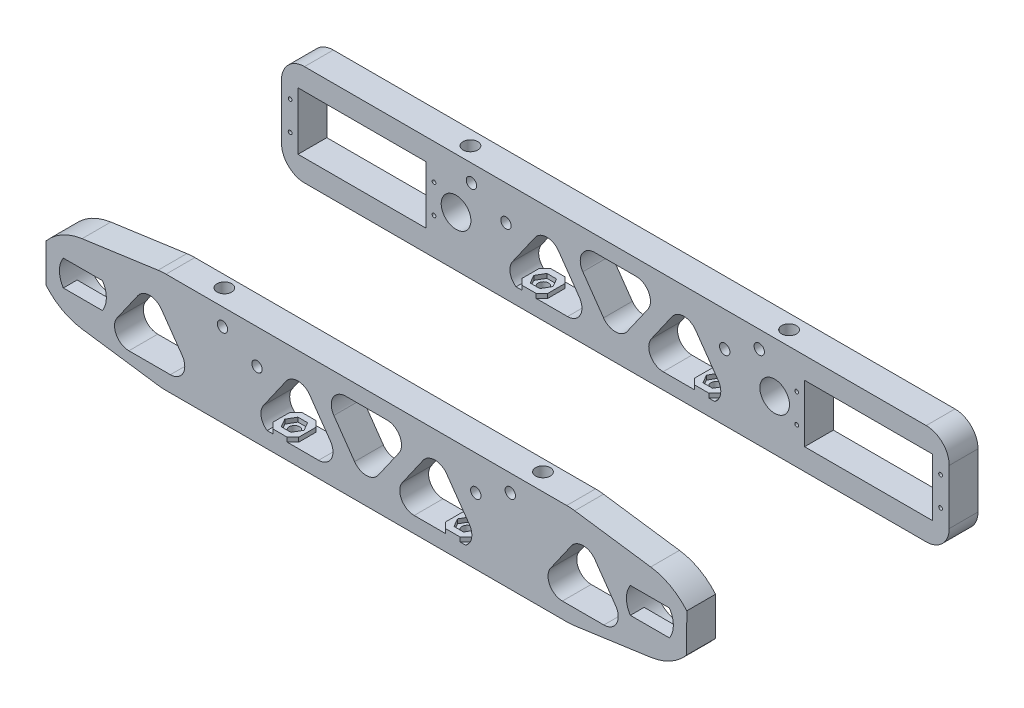
from build123d import *
from OCP.BRepFilletAPI import BRepFilletAPI_MakeChamfer

# Parameters (mm, degrees)
SKETCH1_W           = 232
SKETCH1_H           = 35
SKETCH1_R           = 5.15
BOSS_EXTRUDE1_DEPTH = 10
BOSS_EXTRUDE2_START = -2
SKETCH2_R           = 5.15
BOSS_EXTRUDE2_DEPTH = 2
SKETCH3_W           = 232
SKETCH3_H           = 35
SKETCH3_R           = 0.65
SKETCH3_R_2         = 5.15
SKETCH3_W_2         = 44.5
SKETCH3_H_2         = 20
BOSS_EXTRUDE3_DEPTH = 10
SKETCH4_R           = 2.55
CUT_EXTRUDE1_DEPTH  = 10
CHAMFER1_SIZE       = 45
CHAMFER1_SIZE2      = 6.324337562
FILLET1_R           = 8
CUT_EXTRUDE3_DEPTH  = 10
SKETCH7_R           = 1.8
CUT_EXTRUDE4_DEPTH  = 10
SKETCH7_3_W         = 9
SKETCH7_3_H         = 10
BOSS_EXTRUDE4_DEPTH = 1.5
CHAMFER2_SIZE       = 2
CHAMFER3_SIZE       = 2
FILLET2_R           = 20
SKETCH1_3_R         = 8.15
CUT_EXTRUDE5_DEPTH  = 5.2
CUT_EXTRUDE6_DEPTH  = 251.062492189
SKETCH9_R           = 0.65
CUT_EXTRUDE7_DEPTH  = 5.2
FILLET3_R           = 5
FILLET4_R           = 5
SKETCH14_R          = 1.8
CUT_EXTRUDE10_DEPTH = 254.695191125


with BuildPart() as part:
    # Sketch1 → Boss-Extrude1 (new body)
    with BuildSketch(Plane.XY):
        with Locations((-116, 17.5)):
            Rectangle(SKETCH1_W, SKETCH1_H)
        with Locations((-171.35, 17.5)):
            Circle(SKETCH1_R, mode=Mode.SUBTRACT)
        with Locations((-60.65, 17.5)):
            Circle(SKETCH1_R, mode=Mode.SUBTRACT)
        Polygon((-156.609961834, 5.5), (-139.804980917, 29.5), (-123, 5.5), align=None, mode=Mode.SUBTRACT)
        Polygon((-132.804980917, 29.5), (-116, 5.5), (-99.195019083, 29.5), align=None, mode=Mode.SUBTRACT)
        Polygon((-92.195019083, 29.5), (-109, 5.5), (-75.390038166, 5.5), align=None, mode=Mode.SUBTRACT)
    extrude(amount=BOSS_EXTRUDE1_DEPTH)

    # Sketch2 → Boss-Extrude2 (add)
    with BuildSketch(Plane.XY.offset(10).offset(BOSS_EXTRUDE2_START)):
        with Locations((-60.65, 17.5)):
            Circle(SKETCH2_R)
        with Locations((-171.35, 17.5)):
            Circle(SKETCH2_R)
    extrude(amount=BOSS_EXTRUDE2_DEPTH)


with BuildPart() as body_2:
    # Sketch3 → Boss-Extrude3 (new body)
    with BuildSketch(Plane.XY.offset(-76.5)):
        with Locations((-116, 17.5)):
            Rectangle(SKETCH3_W, SKETCH3_H)
        with Locations((-179, 12.728163815)):
            Circle(SKETCH3_R, mode=Mode.SUBTRACT)
        with Locations((-179, 22.728163815)):
            Circle(SKETCH3_R, mode=Mode.SUBTRACT)
        with Locations((-229, 12.728163815)):
            Circle(SKETCH3_R, mode=Mode.SUBTRACT)
        with Locations((-229, 22.728163815)):
            Circle(SKETCH3_R, mode=Mode.SUBTRACT)
        with Locations((-171.35, 17.5)):
            Circle(SKETCH3_R_2, mode=Mode.SUBTRACT)
        with Locations(Location((-3, 22.728163815, 0), (0, 0, 180))):
            Circle(SKETCH3_R, mode=Mode.SUBTRACT)
        with Locations(Location((-3, 12.728163815, 0), (0, 0, 180))):
            Circle(SKETCH3_R, mode=Mode.SUBTRACT)
        with Locations(Location((-53, 12.728163815, 0), (0, 0, 180))):
            Circle(SKETCH3_R, mode=Mode.SUBTRACT)
        with Locations(Location((-53, 22.728163815, 0), (0, 0, 180))):
            Circle(SKETCH3_R, mode=Mode.SUBTRACT)
        with Locations(Location((-60.65, 17.5, 0), (0, 0, 180))):
            Circle(SKETCH3_R_2, mode=Mode.SUBTRACT)
        with Locations((-204, 17.5)):
            Rectangle(SKETCH3_W_2, SKETCH3_H_2, mode=Mode.SUBTRACT)
        with Locations((-28, 17.5)):
            Rectangle(SKETCH3_W_2, SKETCH3_H_2, mode=Mode.SUBTRACT)
        Polygon((-92.195019083, 29.5), (-109, 5.5), (-75.390038166, 5.5), align=None, mode=Mode.SUBTRACT)
        Polygon((-116, 5.5), (-99.195019083, 29.5), (-132.804980917, 29.5), align=None, mode=Mode.SUBTRACT)
        Polygon((-123, 5.5), (-156.609961834, 5.5), (-139.804980917, 29.5), align=None, mode=Mode.SUBTRACT)
    extrude(amount=-BOSS_EXTRUDE3_DEPTH)


with BuildPart() as cut_extrude1_tool:
    # Sketch4 → Cut-Extrude1 (new body)
    with BuildSketch(Plane(origin=(0, 35, 0), x_dir=(1, 0, 0), z_dir=(0, 1, 0))):
        with Locations(Location((-171.35, -4, 0), (0, 0, 270))):
            Circle(SKETCH4_R)
        with Locations(Location((-60.65, -4, 0), (0, 0, 90))):
            Circle(SKETCH4_R)
        with Locations(Location((-171.35, 81.5, 0), (0, 0, 270))):
            Circle(SKETCH4_R)
        with Locations(Location((-60.65, 81.5, 0), (0, 0, 90))):
            Circle(SKETCH4_R)
    extrude(amount=-CUT_EXTRUDE1_DEPTH)


with BuildPart() as part_1:
    add(part.part)

    # Cut-Extrude1: cut by cut_extrude1_tool
    add(cut_extrude1_tool.part, mode=Mode.SUBTRACT)

    # Chamfer1: one chamfer whose edges measure the first distance from different faces: ONE call of the kernel's chamfer builder (chamfer() names one face for all edges)
    chamfer1_edges_1 = [part_1.edges().sort_by_distance(p)[0] for p in [
        (0, 0, 5),
        (-232, 0, 5),
    ]]
    chamfer1_side_1 = [part_1.faces().sort_by_distance(p)[0] for p in [
        (-116, 0, 5),
    ]]
    chamfer1_edges_2 = [part_1.edges().sort_by_distance(p)[0] for p in [
        (-232, 35, 5),
        (0, 35, 5),
    ]]
    chamfer1_side_2 = [part_1.faces().sort_by_distance(p)[0] for p in [
        (-116, 35, 5.017926213),
    ]]
    chamfer1 = BRepFilletAPI_MakeChamfer(part_1.part.solid().wrapped)
    for e in chamfer1_edges_1:
        chamfer1.Add(CHAMFER1_SIZE, CHAMFER1_SIZE2, e.wrapped, chamfer1_side_1[0].wrapped)  # the first distance lies on this face
    for e in chamfer1_edges_2:
        chamfer1.Add(CHAMFER1_SIZE, CHAMFER1_SIZE2, e.wrapped, chamfer1_side_2[0].wrapped)  # the first distance lies on this face
    add(Compound.cast(chamfer1.Shape()), mode=Mode.REPLACE)

    # Sketch6 → Cut-Extrude3 (cut)
    with BuildSketch(Plane.XY.offset(10)):
        Polygon((-174.5, 5.5), (-208.109961834, 5.5), (-191.304980917, 29.5), align=None)
        Polygon((-57.5, 5.5), (-23.890038166, 5.5), (-40.695019083, 29.5), align=None)
    extrude(amount=-CUT_EXTRUDE3_DEPTH, mode=Mode.SUBTRACT)


with BuildPart() as body_2_1:
    add(body_2.part)

    # Cut-Extrude1: cut by cut_extrude1_tool
    add(cut_extrude1_tool.part, mode=Mode.SUBTRACT)

    # Fillet1
    fillet1_edges = [body_2_1.edges().sort_by_distance(p)[0] for p in [
        (0, 0, -81.5),
        (-232, 0, -81.5),
        (-232, 35, -81.5),
        (0, 35, -81.5),
    ]]
    fillet(fillet1_edges, radius=FILLET1_R)


with BuildPart() as cut_extrude4_tool:
    # Sketch7 → Cut-Extrude4 (new body)
    with BuildSketch(Plane(origin=(0, 5.5, 0), x_dir=(1, 0, 0), z_dir=(0, 1, 0))):
        with Locations(Location((-146, -5, 0), (0, 0, 180))):
            Circle(SKETCH7_R)
        with Locations(Location((-86, -5, 0), (0, 0, 180))):
            Circle(SKETCH7_R)
        with Locations(Location((-146, 81.5, 0), (0, 0, 180))):
            Circle(SKETCH7_R)
        with Locations(Location((-86, 81.5, 0), (0, 0, 180))):
            Circle(SKETCH7_R)
    extrude(amount=-CUT_EXTRUDE4_DEPTH)


with BuildPart() as part_2:
    add(part_1.part)

    # Cut-Extrude4: cut by cut_extrude4_tool
    add(cut_extrude4_tool.part, mode=Mode.SUBTRACT)



with BuildPart() as body_2_2:
    add(body_2_1.part)

    # Cut-Extrude4: cut by cut_extrude4_tool
    add(cut_extrude4_tool.part, mode=Mode.SUBTRACT)


with BuildPart() as part_3:
    add(part_2.part)

    add(body_2_2.part)  # Boss-Extrude4 merges body 2
    # Sketch7<3> → Boss-Extrude4 (add)
    # profile 1 of 4: a face of its own
    with BuildSketch(Plane(origin=(0, 5.5, 0), x_dir=(1, 0, 0), z_dir=(0, 1, 0))):
        with Locations((-146, -5)):
            Rectangle(SKETCH7_3_W, SKETCH7_3_H)
        Polygon((-147.674315781, -2.1), (-149.348631561, -5), (-147.674315781, -7.9), (-144.325684219, -7.9), (-142.651368439, -5), (-144.325684219, -2.1), align=None, mode=Mode.SUBTRACT)
    # profile 2 of 4: a face of its own
    with BuildSketch(Plane(origin=(0, 5.5, 0), x_dir=(1, 0, 0), z_dir=(0, 1, 0))):
        with Locations((-86, -5)):
            Rectangle(SKETCH7_3_W, SKETCH7_3_H)
        Polygon((-89.348631561, -5), (-87.674315781, -2.1), (-84.325684219, -2.1), (-82.651368439, -5), (-84.325684219, -7.9), (-87.674315781, -7.9), align=None, mode=Mode.SUBTRACT)
    # profile 3 of 4: a face of its own
    with BuildSketch(Plane(origin=(0, 5.5, 0), x_dir=(1, 0, 0), z_dir=(0, 1, 0))):
        with Locations((-86, 81.5)):
            Rectangle(SKETCH7_3_W, SKETCH7_3_H)
        Polygon((-82.651368439, 81.5), (-84.325684219, 84.4), (-87.674315781, 84.4), (-89.348631561, 81.5), (-87.674315781, 78.6), (-84.325684219, 78.6), align=None, mode=Mode.SUBTRACT)
    # profile 4 of 4: a face of its own
    with BuildSketch(Plane(origin=(0, 5.5, 0), x_dir=(1, 0, 0), z_dir=(0, 1, 0))):
        with Locations((-146, 81.5)):
            Rectangle(SKETCH7_3_W, SKETCH7_3_H)
        Polygon((-144.325684219, 78.6), (-147.674315781, 78.6), (-149.348631561, 81.5), (-147.674315781, 84.4), (-144.325684219, 84.4), (-142.651368439, 81.5), align=None, mode=Mode.SUBTRACT)
    extrude(amount=BOSS_EXTRUDE4_DEPTH)

    # Chamfer2
    chamfer2_edges = [part_3.edges().sort_by_distance(p)[0] for p in [
        (-81.5, 6.25, -76.5),
        (-81.5, 6.25, -86.5),
        (-90.5, 6.25, -86.5),
        (-90.5, 6.25, -76.5),
        (-141.5, 6.25, -76.5),
        (-141.5, 6.25, -86.5),
        (-150.5, 6.25, -86.5),
        (-150.5, 6.25, -76.5),
    ]]
    chamfer(chamfer2_edges, length=CHAMFER2_SIZE)

    # Chamfer3
    chamfer3_edges = [part_3.edges().sort_by_distance(p)[0] for p in [
        (-150.5, 6.25, 0),
        (-150.5, 6.25, 10),
        (-141.5, 6.25, 10),
        (-141.5, 6.25, 0),
        (-90.5, 6.25, 0),
        (-90.5, 6.25, 10),
        (-81.5, 6.25, 10),
        (-81.5, 6.25, 0),
    ]]
    chamfer(chamfer3_edges, length=CHAMFER3_SIZE)

    # Fillet2
    # the kernel refuses this fillet: 20 mm, written as the material it takes off along each edge
    with BuildSketch(Plane(origin=(-45, 35, -3.496340597), x_dir=(0.9902680687415703, -0.13917310096006527, 0), z_dir=(0, 0, 1)), Plane(origin=(-45, 0, -3.496340597), x_dir=(-1, 0, 0), z_dir=(0, 0, 1)), Plane(origin=(-187, 0, -3.496340597), x_dir=(-0.9902680687415703, 0.13917310096006638, 0), z_dir=(0, 0, 1))) as fillet2_piece_1:
        with BuildLine():
            CenterArc((FILLET2_R * 0.0699268119435, -FILLET2_R), FILLET2_R, 90, 8)
            Line((-FILLET2_R * 0.0692462890166, -FILLET2_R * 0.00973193125843), (0, 0))
            Line((0, 0), (FILLET2_R * 0.0699268119435, 0))
        make_face()
    extrude(amount=16.992681194, mode=Mode.SUBTRACT)
    with BuildSketch(Plane(origin=(0, 6.324337562, -43.464336891), x_dir=(-0.9902680687415703, -0.13917310096006572, 0), z_dir=(0, 0, 1)), Plane(origin=(0, 28.675662438, -43.464336891), x_dir=(0, -1, 0), z_dir=(0, 0, 1)), Plane(origin=(-232, 6.324337562, -43.464336891), x_dir=(0, 1, 0), z_dir=(0, 0, 1)), Plane(origin=(-232, 28.675662438, -43.464336891), x_dir=(0.9902680687415703, 0.13917310096006563, 0), z_dir=(0, 0, 1))) as fillet2_piece_2:
        with BuildLine():
            CenterArc((FILLET2_R * 0.869286737816, -FILLET2_R), FILLET2_R, 90, 82)
            Line((-FILLET2_R * 0.120981330925, -FILLET2_R * 0.86082689904), (0, 0))
            Line((0, 0), (FILLET2_R * 0.869286737816, 0))
        make_face()
    extrude(amount=96.928673782, mode=Mode.SUBTRACT)
    with BuildSketch(Plane(origin=(-187, 35, -3.496340597), x_dir=(-0.9902680687415706, -0.13917310096006388, 0), z_dir=(0, 0, 1))) as fillet2_piece_3:
        with BuildLine():
            CenterArc((FILLET2_R * 0.0699268119435, FILLET2_R), FILLET2_R, 262, 8)
            Line((-FILLET2_R * 0.0692462890166, FILLET2_R * 0.00973193125843), (0, 0))
            Line((0, 0), (FILLET2_R * 0.0699268119435, 0))
        make_face()
    extrude(amount=16.992681194, mode=Mode.SUBTRACT)

    # Sketch1<3> → Cut-Extrude5 (cut)
    with BuildSketch(Plane.XY):
        with Locations((-214.5, 17.5)):
            Circle(SKETCH1_3_R)
        with Locations((-17.5, 17.5)):
            Circle(SKETCH1_3_R)
    extrude(amount=CUT_EXTRUDE5_DEPTH, mode=Mode.SUBTRACT)

    # Sketch8 → Cut-Extrude6 (cut, through all)
    with BuildSketch(Plane(origin=(0, 0, 0), x_dir=(-1, 0, 0), z_dir=(0, 0, -1))):
        with BuildLine():
            Line((10.704965048, 22), (24.295034952, 22))
            ThreePointArc((24.295034952, 22), (25.65, 17.5), (24.295034952, 13))
            Line((24.295034952, 13), (10.704965048, 13))
            ThreePointArc((10.704965048, 13), (9.35, 17.5), (10.704965048, 22))
        make_face()
        with BuildLine():
            Line((207.704965048, 22), (221.295034952, 22))
            ThreePointArc((221.295034952, 22), (222.65, 17.5), (221.295034952, 13))
            Line((221.295034952, 13), (207.704965048, 13))
            ThreePointArc((207.704965048, 13), (206.35, 17.5), (207.704965048, 22))
        make_face()
    extrude(amount=-CUT_EXTRUDE6_DEPTH, mode=Mode.SUBTRACT)

    # Sketch9 → Cut-Extrude7 (cut)
    with BuildSketch(Plane(origin=(0, 25, 0), x_dir=(1, 0, 0), z_dir=(0, 1, 0))):
        with Locations(Location((-171.35, -4, 0), (0, 0, 270))):
            Circle(SKETCH9_R)
        with Locations(Location((-60.65, -4, 0), (0, 0, 270))):
            Circle(SKETCH9_R)
        with Locations(Location((-60.65, 81.5, 0), (0, 0, 270))):
            Circle(SKETCH9_R)
        with Locations(Location((-171.35, 81.5, 0), (0, 0, 270))):
            Circle(SKETCH9_R)
    extrude(amount=-CUT_EXTRUDE7_DEPTH, mode=Mode.SUBTRACT)

    # Fillet3
    # the kernel refuses this fillet: 5 mm, written as the material it adds along each edge
    with BuildSketch(Plane(origin=(-156.609961834, 5.5, -76.5), x_dir=(1, 0, 0), z_dir=(0, 0, -1))) as fillet3_piece_1:
        with BuildLine():
            CenterArc((8.973756882, -4.098619026), FILLET3_R, 124.94284485, 90.05715515)
            Line((4.877996661, -6.966501208), (4.796081456, -7.023858852))
            Line((4.796081456, -7.023858852), (-0.081915204, -0.057357644))
            Line((-0.081915204, -0.057357644), (0, 0.1))
            ThreePointArc((0, 0.1), (3.054980917, 0.1), (6.052685933, 0.081972381))
            Line((6.052685933, 0.081972381), (6.109961834, 0))
        make_face()
    extrude(amount=10)
    with BuildSketch(Plane(origin=(-92.195019083, 29.5, -76.5), x_dir=(-0.573576436351047, -0.8191520442889911, 0), z_dir=(0, 0, -1)), Plane(origin=(-139.804980917, 29.5, -76.5), x_dir=(-0.5735764363510435, -0.8191520442889936, 0), z_dir=(0, 0, -1))) as fillet3_piece_2:
        with BuildLine():
            CenterArc((FILLET3_R * 1.42814800674, -FILLET3_R), FILLET3_R, 90, 110)
            Line((FILLET3_R * 0.488455385956, -FILLET3_R * 1.34202014333), (FILLET3_R * 0.46966153354, -FILLET3_R * 1.34886054619))
            Line((FILLET3_R * 0.46966153354, -FILLET3_R * 1.34886054619), (-FILLET3_R * 0.0285629601348, FILLET3_R * 0.02))
            Line((-FILLET3_R * 0.0285629601348, FILLET3_R * 0.02), (FILLET3_R * 1.42814800674, FILLET3_R * 0.02))
            Line((FILLET3_R * 1.42814800674, FILLET3_R * 0.02), (FILLET3_R * 1.42814800674, 0))
        make_face()
    extrude(amount=10)
    with BuildSketch(Plane(origin=(-75.390038166, 5.5, -76.5), x_dir=(-0.5735764363510428, 0.8191520442889941, 0), z_dir=(0, 0, -1))) as fillet3_piece_3:
        with BuildLine():
            CenterArc((8.504527647, -5), FILLET3_R, 90, 90.05715515)
            Line((3.504530135, -5.004987727), (3.404530185, -5.005087481))
            ThreePointArc((3.404530185, -5.005087481), (1.670349863, -2.559851507), (-0.081915204, -0.057357644))
            Line((-0.081915204, -0.057357644), (0, 0.1))
            Line((0, 0.1), (8.504527647, 0.1))
            Line((8.504527647, 0.1), (8.504527647, 0))
        make_face()
    extrude(amount=10)
    with BuildSketch(Plane(origin=(-109, 5.5, -76.5), x_dir=(1, 0, 0), z_dir=(0, 0, -1)), Plane(origin=(-132.804980917, 29.5, -76.5), x_dir=(0.5735764363510458, -0.819152044288992, 0), z_dir=(0, 0, -1)), Plane(origin=(-99.195019083, 29.5, -76.5), x_dir=(-1, 0, 0), z_dir=(0, 0, -1)), Plane(origin=(-123, 5.5, -76.5), x_dir=(-0.5735764363510468, 0.8191520442889912, 0), z_dir=(0, 0, -1))) as fillet3_piece_4:
        with BuildLine():
            CenterArc((FILLET3_R * 1.92098212697, -FILLET3_R), FILLET3_R, 90, 125)
            Line((FILLET3_R * 1.10183008268, -FILLET3_R * 1.57357643635), (FILLET3_R * 1.0854470418, -FILLET3_R * 1.58504796508))
            Line((FILLET3_R * 1.0854470418, -FILLET3_R * 1.58504796508), (-FILLET3_R * 0.0163830408858, -FILLET3_R * 0.011471528727))
            Line((-FILLET3_R * 0.0163830408858, -FILLET3_R * 0.011471528727), (0, FILLET3_R * 0.02))
            Line((0, FILLET3_R * 0.02), (FILLET3_R * 1.92098212697, FILLET3_R * 0.02))
            Line((FILLET3_R * 1.92098212697, FILLET3_R * 0.02), (FILLET3_R * 1.92098212697, 0))
        make_face()
    extrude(amount=10)
    with BuildSketch(Plane(origin=(-116, 5.5, -76.5), x_dir=(-0.5735764363510453, 0.8191520442889924, 0), z_dir=(0, 0, -1))) as fillet3_piece_5:
        with BuildLine():
            CenterArc((FILLET3_R * 1.42814800674, FILLET3_R), FILLET3_R, 160, 110)
            Line((FILLET3_R * 0.488455385956, FILLET3_R * 1.34202014333), (FILLET3_R * 0.46966153354, FILLET3_R * 1.34886054619))
            Line((FILLET3_R * 0.46966153354, FILLET3_R * 1.34886054619), (-FILLET3_R * 0.0285629601348, -FILLET3_R * 0.02))
            Line((-FILLET3_R * 0.0285629601348, -FILLET3_R * 0.02), (FILLET3_R * 1.42814800674, -FILLET3_R * 0.02))
            Line((FILLET3_R * 1.42814800674, -FILLET3_R * 0.02), (FILLET3_R * 1.42814800674, 0))
        make_face()
    extrude(amount=10)

    # Fillet4
    # the kernel refuses this fillet: 5 mm, written as the material it adds along each edge
    with BuildSketch(Plane(origin=(-40.695019083, 29.5, 10), x_dir=(-0.5735764363510464, -0.8191520442889916, 0), z_dir=(0, 0, -1)), Plane(origin=(-139.804980917, 29.5, 0), x_dir=(0.5735764363510456, -0.819152044288992, 0), z_dir=(0, 0, 1)), Plane(origin=(-116, 5.5, 0), x_dir=(-0.5735764363510455, 0.8191520442889922, 0), z_dir=(0, 0, 1))) as fillet4_piece_1:
        with BuildLine():
            CenterArc((FILLET4_R * 1.42814800674, -FILLET4_R), FILLET4_R, 90, 110)
            Line((FILLET4_R * 0.488455385956, -FILLET4_R * 1.34202014333), (FILLET4_R * 0.46966153354, -FILLET4_R * 1.34886054619))
            Line((FILLET4_R * 0.46966153354, -FILLET4_R * 1.34886054619), (-FILLET4_R * 0.0285629601348, FILLET4_R * 0.02))
            Line((-FILLET4_R * 0.0285629601348, FILLET4_R * 0.02), (FILLET4_R * 1.42814800674, FILLET4_R * 0.02))
            Line((FILLET4_R * 1.42814800674, FILLET4_R * 0.02), (FILLET4_R * 1.42814800674, 0))
        make_face()
    extrude(amount=10)
    with BuildSketch(Plane(origin=(-23.890038166, 5.5, 10), x_dir=(-0.5735764363510432, 0.8191520442889938, 0), z_dir=(0, 0, -1)), Plane(origin=(-208.109961834, 5.5, 10), x_dir=(1, 0, 0), z_dir=(0, 0, -1)), Plane(origin=(-123, 5.5, 0), x_dir=(-1, 0, 0), z_dir=(0, 0, 1))) as fillet4_piece_2:
        with BuildLine():
            CenterArc((FILLET4_R * 1.92098212697, -FILLET4_R), FILLET4_R, 90, 125)
            Line((FILLET4_R * 1.10183008268, -FILLET4_R * 1.57357643635), (FILLET4_R * 1.0854470418, -FILLET4_R * 1.58504796508))
            Line((FILLET4_R * 1.0854470418, -FILLET4_R * 1.58504796508), (-FILLET4_R * 0.0163830408858, -FILLET4_R * 0.011471528727))
            Line((-FILLET4_R * 0.0163830408858, -FILLET4_R * 0.011471528727), (0, FILLET4_R * 0.02))
            Line((0, FILLET4_R * 0.02), (FILLET4_R * 1.92098212697, FILLET4_R * 0.02))
            Line((FILLET4_R * 1.92098212697, FILLET4_R * 0.02), (FILLET4_R * 1.92098212697, 0))
        make_face()
    extrude(amount=10)
    with BuildSketch(Plane(origin=(-57.5, 5.5, 10), x_dir=(0.5735764363510462, 0.8191520442889918, 0), z_dir=(0, 0, -1)), Plane(origin=(-174.5, 5.5, 10), x_dir=(-1, 0, 0), z_dir=(0, 0, -1)), Plane(origin=(-132.804980917, 29.5, 0), x_dir=(0.5735764363510468, -0.8191520442889912, 0), z_dir=(0, 0, 1)), Plane(origin=(-99.195019083, 29.5, 0), x_dir=(-1, 0, 0), z_dir=(0, 0, 1)), Plane(origin=(-109, 5.5, 0), x_dir=(1, 0, 0), z_dir=(0, 0, 1))) as fillet4_piece_3:
        with BuildLine():
            CenterArc((FILLET4_R * 1.92098212697, FILLET4_R), FILLET4_R, 145, 125)
            Line((FILLET4_R * 1.10183008268, FILLET4_R * 1.57357643635), (FILLET4_R * 1.0854470418, FILLET4_R * 1.58504796508))
            Line((FILLET4_R * 1.0854470418, FILLET4_R * 1.58504796508), (-FILLET4_R * 0.0163830408858, FILLET4_R * 0.011471528727))
            Line((-FILLET4_R * 0.0163830408858, FILLET4_R * 0.011471528727), (0, -FILLET4_R * 0.02))
            Line((0, -FILLET4_R * 0.02), (FILLET4_R * 1.92098212697, -FILLET4_R * 0.02))
            Line((FILLET4_R * 1.92098212697, -FILLET4_R * 0.02), (FILLET4_R * 1.92098212697, 0))
        make_face()
    extrude(amount=10)
    with BuildSketch(Plane(origin=(-191.304980917, 29.5, 10), x_dir=(0.5735764363510456, -0.819152044288992, 0), z_dir=(0, 0, -1)), Plane(origin=(-92.195019083, 29.5, 0), x_dir=(-0.5735764363510464, -0.8191520442889916, 0), z_dir=(0, 0, 1))) as fillet4_piece_4:
        with BuildLine():
            CenterArc((FILLET4_R * 1.42814800674, FILLET4_R), FILLET4_R, 160, 110)
            Line((FILLET4_R * 0.488455385956, FILLET4_R * 1.34202014333), (FILLET4_R * 0.46966153354, FILLET4_R * 1.34886054619))
            Line((FILLET4_R * 0.46966153354, FILLET4_R * 1.34886054619), (-FILLET4_R * 0.0285629601348, -FILLET4_R * 0.02))
            Line((-FILLET4_R * 0.0285629601348, -FILLET4_R * 0.02), (FILLET4_R * 1.42814800674, -FILLET4_R * 0.02))
            Line((FILLET4_R * 1.42814800674, -FILLET4_R * 0.02), (FILLET4_R * 1.42814800674, 0))
        make_face()
    extrude(amount=10)
    with BuildSketch(Plane(origin=(-156.609961834, 5.5, 0), x_dir=(1, 0, 0), z_dir=(0, 0, 1))) as fillet4_piece_5:
        with BuildLine():
            CenterArc((8.973756882, 4.098619026), FILLET4_R, 145, 90.05715515)
            Line((4.877996661, 6.966501208), (4.796081456, 7.023858852))
            Line((4.796081456, 7.023858852), (-0.081915204, 0.057357644))
            Line((-0.081915204, 0.057357644), (0, -0.1))
            ThreePointArc((0, -0.1), (3.054980917, -0.1), (6.052685933, -0.081972381))
            Line((6.052685933, -0.081972381), (6.109961834, 0))
        make_face()
    extrude(amount=10)
    with BuildSketch(Plane(origin=(-75.390038166, 5.5, 0), x_dir=(-1, 0, 0), z_dir=(0, 0, 1))) as fillet4_piece_6:
        with BuildLine():
            CenterArc((8.973756882, -4.098619026), FILLET4_R, 124.94284485, 90.05715515)
            Line((4.877996661, -6.966501208), (4.796081456, -7.023858852))
            Line((4.796081456, -7.023858852), (-0.081915204, -0.057357644))
            Line((-0.081915204, -0.057357644), (0, 0.1))
            ThreePointArc((0, 0.1), (3.054980917, 0.1), (6.052685933, 0.081972381))
            Line((6.052685933, 0.081972381), (6.109961834, 0))
        make_face()
    extrude(amount=10)

    # Chamfer6
    # the kernel refuses this chamfer: 12, 11.885669837 mm, written as the material it takes off along each edge
    with BuildSketch(Plane(origin=(-0.98855603, 17.5, 30.169052095), x_dir=(-0.4857396001369698, 0.8741035641494529, 0), z_dir=(0, 0, -1))) as chamfer6_piece_1:
        with BuildLine():
            Line((7.61272969, 0), (-4.031919792, -6.494784751))
            ThreePointArc((-4.031919792, -6.494784751), (-2.440295879, -3.234133381), (0, 0))
            ThreePointArc((0, 0), (4.018593862, 0.364424961), (7.61272969, 0))
        make_face()
    extrude(amount=50.338104191, mode=Mode.SUBTRACT)
    with BuildSketch(Plane(origin=(-231.01144397, 17.5, 30.169052095), x_dir=(0.48573960013790857, 0.8741035641489312, 0), z_dir=(0, 0, -1))) as chamfer6_piece_2:
        with BuildLine():
            Line((7.61272969, 0), (-4.031919792, 6.494784751))
            ThreePointArc((-4.031919792, 6.494784751), (-2.440295879, 3.234133381), (0, 0))
            ThreePointArc((0, 0), (4.018593862, -0.364424961), (7.61272969, 0))
        make_face()
    extrude(amount=50.338104191, mode=Mode.SUBTRACT)

    # Sketch14 → Cut-Extrude10 (cut, through all)
    with BuildSketch(Plane(origin=(0, 0, -86.5), x_dir=(-1, 0, 0), z_dir=(0, 0, -1))):
        with Locations((78, 23)):
            Circle(SKETCH14_R)
        with Locations((66, 29)):
            Circle(SKETCH14_R)
        with Locations(Location((166, 29, 0), (0, 0, 180))):
            Circle(SKETCH14_R)
        with Locations(Location((154, 23, 0), (0, 0, 180))):
            Circle(SKETCH14_R)
    extrude(amount=-CUT_EXTRUDE10_DEPTH, mode=Mode.SUBTRACT)


solid = part_3.part
